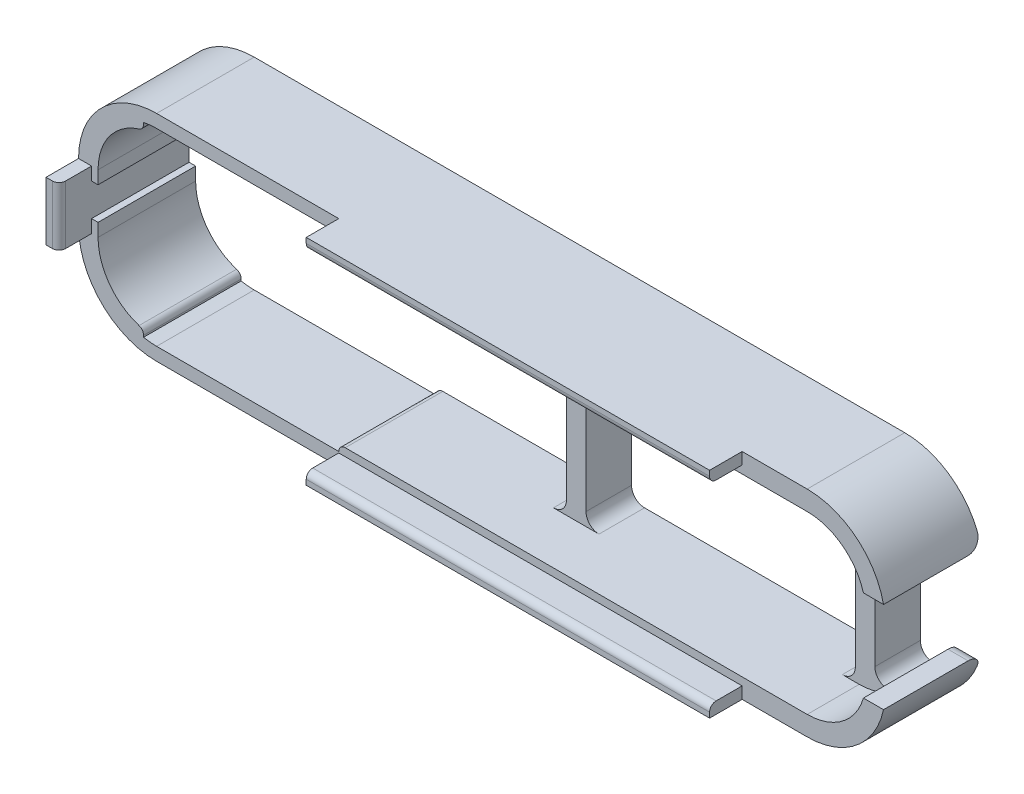
from build123d import *

# Parameters (mm, degrees)
BOSS_EXTRUDE2_DEPTH                    = 15
SKETCH4_W                              = 3
SKETCH4_H                              = 27
BOSS_EXTRUDE4_CROSS_STRUCTURES_DEPTH   = 15
SKETCH6_W                              = 3
SKETCH6_H                              = 27
CUT_EXTRUDE3_8_MM_SPACING_DEPTH        = 8
CUT_EXTRUDE4_ELECTRONICS_SPACING_DEPTH = 125.021167548
SKETCH8_W                              = 15
SKETCH8_H                              = 14
CUT_EXTRUDE2_USB_C_CUTOUT_DEPTH        = 5
FILLET2_USBC_R                         = 2
FILLET3_INNER_CORNERS_FRONT_R          = 1
FILLET5_INNER_CORNERS_R                = 2
SKETCH18_W                             = 62
SKETCH18_H                             = 1.8
SKETCH18_W_2                           = 2
SKETCH18_H_2                           = 9
BOSS_EXTRUDE7_DEPTH                    = 5
FILLET1_R                              = 1
SKETCH19_W                             = 1
SKETCH19_H                             = 5
CUT_EXTRUDE1_DEPTH                     = 124.762162398


with BuildPart() as part:
    # Sketch3 → Boss-Extrude2 (new body)
    with BuildSketch(Plane.XY.offset(-1.6194024)):
        with BuildLine():
            Line((110, 16.5), (10, 16.5))
            ThreePointArc((10, 16.5), (1.514718626, 12.985281374), (-2, 4.5))
            Line((-2, 4.5), (-2, -4.5))
            ThreePointArc((-2, -4.5), (1.514718626, -12.985281374), (10, -16.5))
            Line((10, -16.5), (110, -16.5))
            ThreePointArc((110, -16.5), (118.485281374, -12.985281374), (122, -4.5))
            Line((122, -4.5), (122, 4.5))
            ThreePointArc((122, 4.5), (118.485281374, 12.985281374), (110, 16.5))
        make_face()
        with BuildLine():
            Line((119, -4.5), (119, 4.5))
            ThreePointArc((119, 4.5), (116.363961031, 10.863961031), (110, 13.5))
            Line((110, 13.5), (10, 13.5))
            ThreePointArc((10, 13.5), (3.636038969, 10.863961031), (1, 4.5))
            Line((1, 4.5), (1, -4.5))
            ThreePointArc((1, -4.5), (3.636038969, -10.863961031), (10, -13.5))
            Line((10, -13.5), (110, -13.5))
            ThreePointArc((110, -13.5), (116.363961031, -10.863961031), (119, -4.5))
        make_face(mode=Mode.SUBTRACT)
    extrude(amount=-BOSS_EXTRUDE2_DEPTH)

    # Sketch4 → Boss-Extrude4 - cross structures (add)
    with BuildSketch(Plane.XY.offset(-1.6194024)):
        with Locations((110.9, 0)):
            Rectangle(SKETCH4_W, SKETCH4_H)
        with Locations((66.5, 0)):
            Rectangle(SKETCH4_W, SKETCH4_H)
    extrude(amount=-BOSS_EXTRUDE4_CROSS_STRUCTURES_DEPTH)

    # Sketch6 → Cut-Extrude3 - 8 mm spacing (cut)
    with BuildSketch(Plane.XY.offset(-1.6194024)):
        with BuildLine():
            Line((109.4, 13.5), (110, 13.5))
            ThreePointArc((110, 13.5), (111.211013131, 13.418152678), (112.4, 13.174099377))
            Line((112.4, 13.174099377), (112.4, -13.174099377))
            ThreePointArc((112.4, -13.174099377), (111.211013131, -13.418152678), (110, -13.5))
            Line((110, -13.5), (109.4, -13.5))
            Line((109.4, -13.5), (109.4, 13.5))
        make_face()
        with Locations((66.5, 0)):
            Rectangle(SKETCH6_W, SKETCH6_H)
    extrude(amount=-CUT_EXTRUDE3_8_MM_SPACING_DEPTH, mode=Mode.SUBTRACT)

    # Sketch7 → Cut-Extrude4 - electronics spacing (cut, through all)
    with BuildSketch(Plane.XY.offset(-1.6194024)):
        with BuildLine():
            Line((38, -14.5), (10, -14.5))
            ThreePointArc((10, -14.5), (8.99491038, -14.44936153), (8, -14.297958971))
            Line((8, -14.297958971), (8, 14.297958971))
            ThreePointArc((8, 14.297958971), (8.99491038, 14.44936153), (10, 14.5))
            Line((10, 14.5), (38, 14.5))
            Line((38, 14.5), (38, -14.5))
        make_face()
    extrude(amount=-CUT_EXTRUDE4_ELECTRONICS_SPACING_DEPTH, mode=Mode.SUBTRACT)

    # Sketch8 → Cut-Extrude2 - USB-C cutout (cut)
    with BuildSketch(Plane(origin=(122, 0, 0), x_dir=(0, 0, -1), z_dir=(1, 0, 0))):
        with Locations((9.1194024, 0)):
            Rectangle(SKETCH8_W, SKETCH8_H)
    extrude(amount=-CUT_EXTRUDE2_USB_C_CUTOUT_DEPTH, mode=Mode.SUBTRACT)

    # Fillet2 - USBC
    fillet2_usbc_edges = [part.edges().sort_by_distance(p)[0] for p in [
        (120.191251414, 7, -16.6194024),
        (120.191251414, -7, -16.6194024),
    ]]
    fillet(fillet2_usbc_edges, radius=FILLET2_USBC_R)

    # Fillet3 - inner corners, front
    fillet3_inner_corners_front_edges = [part.edges().sort_by_distance(p)[0] for p in [
        (38, 13.5, -9.1194024),
        (38, -13.5, -9.1194024),
        (8, -13.274964387, -9.1194024),
        (8, 13.274964387, -9.1194024),
    ]]
    fillet(fillet3_inner_corners_front_edges, radius=FILLET3_INNER_CORNERS_FRONT_R - 0.0001)  # a hair under: the kernel refuses the full size

    # Fillet5 - inner corners
    fillet5_inner_corners_edges = [part.edges().sort_by_distance(p)[0] for p in [
        (112.4, -13.174099377, -13.1194024),
        (109.4, -13.5, -13.1194024),
        (109.4, 13.5, -13.1194024),
        (65, -13.5, -13.1194024),
        (65, 13.5, -13.1194024),
        (68, 13.5, -13.1194024),
        (68, -13.5, -13.1194024),
        (112.4, 13.174099377, -13.1194024),
    ]]
    fillet(fillet5_inner_corners_edges, radius=FILLET5_INNER_CORNERS_R)

    # Sketch18 → Boss-Extrude7 (add)
    with BuildSketch(Plane.XY.offset(-1.6194024)):
        with Locations((69, 15.6)):
            Rectangle(SKETCH18_W, SKETCH18_H)
        with Locations((69, -15.6)):
            Rectangle(SKETCH18_W, SKETCH18_H)
        with Locations((-1, 0)):
            Rectangle(SKETCH18_W_2, SKETCH18_H_2)
    extrude(amount=BOSS_EXTRUDE7_DEPTH)

    # Fillet1
    fillet1_edges = [part.edges().sort_by_distance(p)[0] for p in [
        (69, 14.7, 3.3805976),
        (69, -14.7, 3.3805976),
        (0, 0, 3.3805976),
    ]]
    fillet(fillet1_edges, radius=FILLET1_R)

    # Sketch19 → Cut-Extrude1 (cut, through all)
    with BuildSketch(Plane.XY.offset(-1.6194024)):
        with Locations((0.5, 0)):
            Rectangle(SKETCH19_W, SKETCH19_H)
    extrude(amount=-CUT_EXTRUDE1_DEPTH, mode=Mode.SUBTRACT)


solid = part.part
